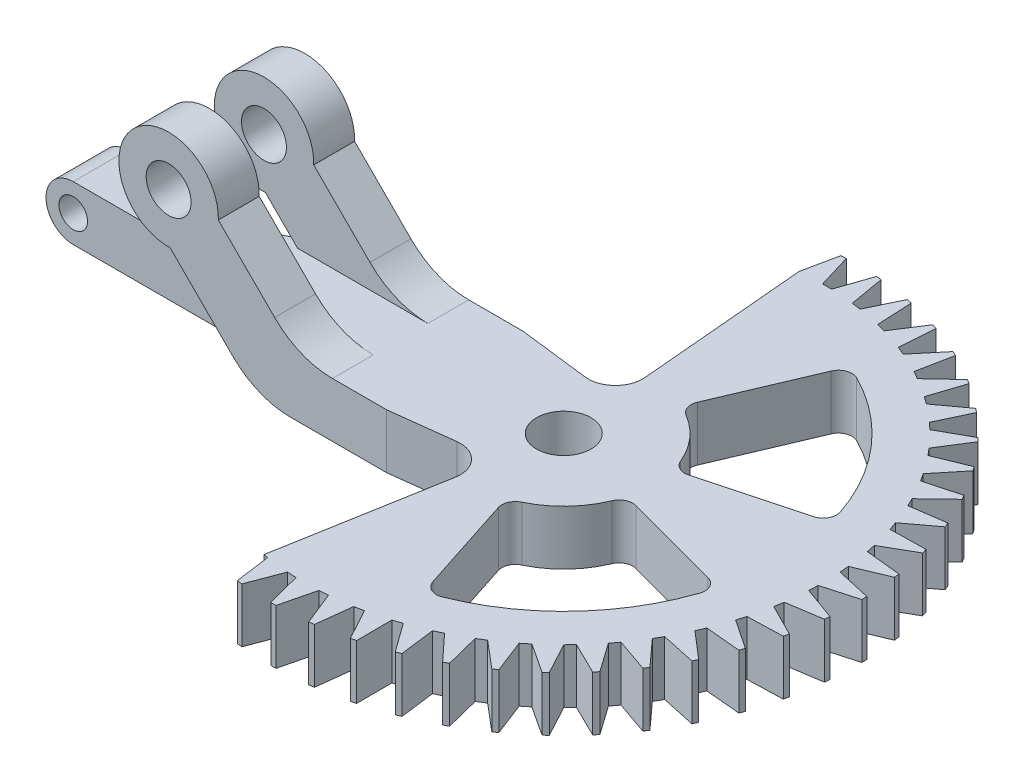
from build123d import *

# Parameters (mm, degrees)
SKETCH1_R           = 1.65
BOSS_EXTRUDE1_DEPTH = 5
SKETCH3_W           = 10.114466094
SKETCH3_H           = 4
CUT_EXTRUDE1_DEPTH  = 22.617643257
SKETCH4_R           = 2
BOSS_EXTRUDE2_DEPTH = 4
SKETCH5_R           = 1.05
BOSS_EXTRUDE3_DEPTH = 2
CUT_EXTRUDE3_REACH  = 54.142
CIRPATTERN2_COUNT   = 29
CIRPATTERN2_ANGLE   = 196
CUT_EXTRUDE4_REACH  = 53.238
FILLET3_R           = 1
SKETCH9_W           = 5
SKETCH9_H           = 4
CUT_EXTRUDE6_DEPTH  = 52.237920784
FILLET4_R           = 6
FILLET5_R           = 2


with BuildPart() as part:
    # Sketch1 → Boss-Extrude1 (new, symmetric)
    with BuildSketch(Plane.XY):
        with BuildLine():
            Line((6.464466094, -10), (16, -10))
            Line((16, -10), (16, -6))
            Line((16, -6), (9.535533906, -6))
            Line((9.535533906, -6), (3.64825891, -0.112725004))
            ThreePointArc((3.64825891, -0.112725004), (-2.580939751, 2.580939751), (0.112725004, -3.64825891))
            Line((0.112725004, -3.64825891), (6.464466094, -10))
        make_face()
        Circle(SKETCH1_R, mode=Mode.SUBTRACT)
    extrude(amount=BOSS_EXTRUDE1_DEPTH, both=True)

    # Sketch3 → Cut-Extrude1 (cut, through all)
    with BuildSketch(Plane.XZ.offset(10)):
        with Locations((1.407233047, 0)):
            Rectangle(SKETCH3_W, SKETCH3_H)
    extrude(amount=-CUT_EXTRUDE1_DEPTH, mode=Mode.SUBTRACT)

    # Sketch4 → Boss-Extrude2 (add)
    with BuildSketch(Plane.XZ.offset(10)):
        with BuildLine():
            Line((16, 5), (16, -5))
            Line((16, -5), (21.195465554, -4.369618468))
            ThreePointArc((21.195465554, -4.369618468), (22.826710059, -4.917371633), (23.428754248, -6.529368829))
            Line((23.428754248, -6.529368829), (22.126151531, -21.418186009))
            ThreePointArc((22.126151531, -21.418186009), (45.479536764, 0.937816828), (20.26656418, 21.17336669))
            Line((20.26656418, 21.17336669), (22.805344024, 6.77523072))
            ThreePointArc((22.805344024, 6.77523072), (22.287461395, 5.052263018), (20.59482922, 4.442495489))
            Line((20.59482922, 4.442495489), (16, 5))
        make_face()
        with Locations(Location((24, 0, 0), (0, 0, 270))):
            Circle(SKETCH4_R, mode=Mode.SUBTRACT)
    extrude(amount=-BOSS_EXTRUDE2_DEPTH)

    # Sketch5 → Boss-Extrude3 (add, symmetric)
    with BuildSketch(Plane.XY):
        with BuildLine():
            Line((6.464466094, -10), (-10, -10))
            ThreePointArc((-10, -10), (-12, -8), (-10, -6))
            Line((-10, -6), (9.535533906, -6))
            Line((9.535533906, -6), (16, -6))
            Line((16, -6), (16, -10))
            Line((16, -10), (6.464466094, -10))
        make_face()
        with Locations((-10, -8)):
            Circle(SKETCH5_R, mode=Mode.SUBTRACT)
    extrude(amount=BOSS_EXTRUDE3_DEPTH, both=True)

    # Sketch7 → Cut-Extrude3 (cut, up to next)
    with BuildSketch(Plane.XZ.offset(10), mode=Mode.PRIVATE) as cut_extrude3_sk1:
        with BuildLine():
            Line((20.636659002, -21.235299323), (21.684482475, -18.858376881))
            ThreePointArc((21.684482475, -18.858376881), (22.013959198, -18.895916012), (22.344040888, -18.927699264))
            Line((22.344040888, -18.927699264), (22.874776941, -21.470534997))
            ThreePointArc((22.874776941, -21.470534997), (21.75263804, -21.38222075), (20.636659002, -21.235299323))
        make_face()
    cut_extrude3_tool1 = extrude(cut_extrude3_sk1.sketch, amount=-CUT_EXTRUDE3_REACH, mode=Mode.PRIVATE) & part.part
    cut_extrude3 = cut_extrude3_tool1.solids().sort_by_distance((21.860164, -10, -20.359178))[0]
    add(cut_extrude3, mode=Mode.SUBTRACT)

    # CirPattern2: Cut-Extrude3; each copy of Cut-Extrude3 runs up to whatever stops it at its own place
    cirpattern2_before = part.part  # the part as the pattern finds it: every copy runs up to it
    cirpattern2_cut_extrude3_long = extrude(cut_extrude3_sk1.sketch, amount=-CUT_EXTRUDE3_REACH, mode=Mode.PRIVATE)
    cirpattern2_cut_extrude3_tool1 = cirpattern2_cut_extrude3_long.rotate(Axis((24, 0, 0), (0, -1, 0)), 1 * CIRPATTERN2_ANGLE / (CIRPATTERN2_COUNT - 1)) & cirpattern2_before
    add(cirpattern2_cut_extrude3_tool1.solids().sort_by_distance((24.357274, -10, -20.468204))[0], mode=Mode.SUBTRACT)
    cirpattern2_cut_extrude3_tool2 = cirpattern2_cut_extrude3_long.rotate(Axis((24, 0, 0), (0, -1, 0)), 2 * CIRPATTERN2_ANGLE / (CIRPATTERN2_COUNT - 1)) & cirpattern2_before
    add(cirpattern2_cut_extrude3_tool2.solids().sort_by_distance((26.849057, -10, -20.272097))[0], mode=Mode.SUBTRACT)
    cirpattern2_cut_extrude3_tool3 = cirpattern2_cut_extrude3_long.rotate(Axis((24, 0, 0), (0, -1, 0)), 3 * CIRPATTERN2_ANGLE / (CIRPATTERN2_COUNT - 1)) & cirpattern2_before
    add(cirpattern2_cut_extrude3_tool3.solids().sort_by_distance((29.298368, -10, -19.773779))[0], mode=Mode.SUBTRACT)
    cirpattern2_cut_extrude3_tool4 = cirpattern2_cut_extrude3_long.rotate(Axis((24, 0, 0), (0, -1, 0)), 4 * CIRPATTERN2_ANGLE / (CIRPATTERN2_COUNT - 1)) & cirpattern2_before
    add(cirpattern2_cut_extrude3_tool4.solids().sort_by_distance((31.668692, -10, -18.980679))[0], mode=Mode.SUBTRACT)
    cirpattern2_cut_extrude3_tool5 = cirpattern2_cut_extrude3_long.rotate(Axis((24, 0, 0), (0, -1, 0)), 5 * CIRPATTERN2_ANGLE / (CIRPATTERN2_COUNT - 1)) & cirpattern2_before
    add(cirpattern2_cut_extrude3_tool5.solids().sort_by_distance((33.924694, -10, -17.904622))[0], mode=Mode.SUBTRACT)
    cirpattern2_cut_extrude3_tool6 = cirpattern2_cut_extrude3_long.rotate(Axis((24, 0, 0), (0, -1, 0)), 6 * CIRPATTERN2_ANGLE / (CIRPATTERN2_COUNT - 1)) & cirpattern2_before
    add(cirpattern2_cut_extrude3_tool6.solids().sort_by_distance((36.032741, -10, -16.561648))[0], mode=Mode.SUBTRACT)
    cirpattern2_cut_extrude3_tool7 = cirpattern2_cut_extrude3_long.rotate(Axis((24, 0, 0), (0, -1, 0)), 7 * CIRPATTERN2_ANGLE / (CIRPATTERN2_COUNT - 1)) & cirpattern2_before
    add(cirpattern2_cut_extrude3_tool7.solids().sort_by_distance((37.961408, -10, -14.971777))[0], mode=Mode.SUBTRACT)
    cirpattern2_cut_extrude3_tool8 = cirpattern2_cut_extrude3_long.rotate(Axis((24, 0, 0), (0, -1, 0)), 8 * CIRPATTERN2_ANGLE / (CIRPATTERN2_COUNT - 1)) & cirpattern2_before
    add(cirpattern2_cut_extrude3_tool8.solids().sort_by_distance((39.681942, -10, -13.158712))[0], mode=Mode.SUBTRACT)
    cirpattern2_cut_extrude3_tool9 = cirpattern2_cut_extrude3_long.rotate(Axis((24, 0, 0), (0, -1, 0)), 9 * CIRPATTERN2_ANGLE / (CIRPATTERN2_COUNT - 1)) & cirpattern2_before
    add(cirpattern2_cut_extrude3_tool9.solids().sort_by_distance((41.168695, -10, -11.149481))[0], mode=Mode.SUBTRACT)
    cirpattern2_cut_extrude3_tool10 = cirpattern2_cut_extrude3_long.rotate(Axis((24, 0, 0), (0, -1, 0)), 10 * CIRPATTERN2_ANGLE / (CIRPATTERN2_COUNT - 1)) & cirpattern2_before
    add(cirpattern2_cut_extrude3_tool10.solids().sort_by_distance((42.399502, -10, -8.974037))[0], mode=Mode.SUBTRACT)
    cirpattern2_cut_extrude3_tool11 = cirpattern2_cut_extrude3_long.rotate(Axis((24, 0, 0), (0, -1, 0)), 11 * CIRPATTERN2_ANGLE / (CIRPATTERN2_COUNT - 1)) & cirpattern2_before
    add(cirpattern2_cut_extrude3_tool11.solids().sort_by_distance((43.356015, -10, -6.664811))[0], mode=Mode.SUBTRACT)
    cirpattern2_cut_extrude3_tool12 = cirpattern2_cut_extrude3_long.rotate(Axis((24, 0, 0), (0, -1, 0)), 12 * CIRPATTERN2_ANGLE / (CIRPATTERN2_COUNT - 1)) & cirpattern2_before
    add(cirpattern2_cut_extrude3_tool12.solids().sort_by_distance((44.023975, -10, -4.256227))[0], mode=Mode.SUBTRACT)
    cirpattern2_cut_extrude3_tool13 = cirpattern2_cut_extrude3_long.rotate(Axis((24, 0, 0), (0, -1, 0)), 13 * CIRPATTERN2_ANGLE / (CIRPATTERN2_COUNT - 1)) & cirpattern2_before
    add(cirpattern2_cut_extrude3_tool13.solids().sort_by_distance((44.393422, -10, -1.784193))[0], mode=Mode.SUBTRACT)
    cirpattern2_cut_extrude3_tool14 = cirpattern2_cut_extrude3_long.rotate(Axis((24, 0, 0), (0, -1, 0)), 14 * CIRPATTERN2_ANGLE / (CIRPATTERN2_COUNT - 1)) & cirpattern2_before
    add(cirpattern2_cut_extrude3_tool14.solids().sort_by_distance((44.458851, -10, 0.714439))[0], mode=Mode.SUBTRACT)
    cirpattern2_cut_extrude3_tool15 = cirpattern2_cut_extrude3_long.rotate(Axis((24, 0, 0), (0, -1, 0)), 15 * CIRPATTERN2_ANGLE / (CIRPATTERN2_COUNT - 1)) & cirpattern2_before
    add(cirpattern2_cut_extrude3_tool15.solids().sort_by_distance((44.219286, -10, 3.20242))[0], mode=Mode.SUBTRACT)
    cirpattern2_cut_extrude3_tool16 = cirpattern2_cut_extrude3_long.rotate(Axis((24, 0, 0), (0, -1, 0)), 16 * CIRPATTERN2_ANGLE / (CIRPATTERN2_COUNT - 1)) & cirpattern2_before
    add(cirpattern2_cut_extrude3_tool16.solids().sort_by_distance((43.678298, -10, 5.642661))[0], mode=Mode.SUBTRACT)
    cirpattern2_cut_extrude3_tool17 = cirpattern2_cut_extrude3_long.rotate(Axis((24, 0, 0), (0, -1, 0)), 17 * CIRPATTERN2_ANGLE / (CIRPATTERN2_COUNT - 1)) & cirpattern2_before
    add(cirpattern2_cut_extrude3_tool17.solids().sort_by_distance((42.843951, -10, 7.998783))[0], mode=Mode.SUBTRACT)
    cirpattern2_cut_extrude3_tool18 = cirpattern2_cut_extrude3_long.rotate(Axis((24, 0, 0), (0, -1, 0)), 18 * CIRPATTERN2_ANGLE / (CIRPATTERN2_COUNT - 1)) & cirpattern2_before
    add(cirpattern2_cut_extrude3_tool18.solids().sort_by_distance((41.728685, -10, 10.235661))[0], mode=Mode.SUBTRACT)
    cirpattern2_cut_extrude3_tool19 = cirpattern2_cut_extrude3_long.rotate(Axis((24, 0, 0), (0, -1, 0)), 19 * CIRPATTERN2_ANGLE / (CIRPATTERN2_COUNT - 1)) & cirpattern2_before
    add(cirpattern2_cut_extrude3_tool19.solids().sort_by_distance((40.349125, -10, 12.319949))[0], mode=Mode.SUBTRACT)
    cirpattern2_cut_extrude3_tool20 = cirpattern2_cut_extrude3_long.rotate(Axis((24, 0, 0), (0, -1, 0)), 20 * CIRPATTERN2_ANGLE / (CIRPATTERN2_COUNT - 1)) & cirpattern2_before
    add(cirpattern2_cut_extrude3_tool20.solids().sort_by_distance((38.725837, -10, 14.220575))[0], mode=Mode.SUBTRACT)
    cirpattern2_cut_extrude3_tool21 = cirpattern2_cut_extrude3_long.rotate(Axis((24, 0, 0), (0, -1, 0)), 21 * CIRPATTERN2_ANGLE / (CIRPATTERN2_COUNT - 1)) & cirpattern2_before
    add(cirpattern2_cut_extrude3_tool21.solids().sort_by_distance((36.883021, -10, 15.909205))[0], mode=Mode.SUBTRACT)
    cirpattern2_cut_extrude3_tool22 = cirpattern2_cut_extrude3_long.rotate(Axis((24, 0, 0), (0, -1, 0)), 22 * CIRPATTERN2_ANGLE / (CIRPATTERN2_COUNT - 1)) & cirpattern2_before
    add(cirpattern2_cut_extrude3_tool22.solids().sort_by_distance((34.848148, -10, 17.360666))[0], mode=Mode.SUBTRACT)
    cirpattern2_cut_extrude3_tool23 = cirpattern2_cut_extrude3_long.rotate(Axis((24, 0, 0), (0, -1, 0)), 23 * CIRPATTERN2_ANGLE / (CIRPATTERN2_COUNT - 1)) & cirpattern2_before
    add(cirpattern2_cut_extrude3_tool23.solids().sort_by_distance((32.651555, -10, 18.553319))[0], mode=Mode.SUBTRACT)
    cirpattern2_cut_extrude3_tool24 = cirpattern2_cut_extrude3_long.rotate(Axis((24, 0, 0), (0, -1, 0)), 24 * CIRPATTERN2_ANGLE / (CIRPATTERN2_COUNT - 1)) & cirpattern2_before
    add(cirpattern2_cut_extrude3_tool24.solids().sort_by_distance((30.325987, -10, 19.469384))[0], mode=Mode.SUBTRACT)
    cirpattern2_cut_extrude3_tool25 = cirpattern2_cut_extrude3_long.rotate(Axis((24, 0, 0), (0, -1, 0)), 25 * CIRPATTERN2_ANGLE / (CIRPATTERN2_COUNT - 1)) & cirpattern2_before
    add(cirpattern2_cut_extrude3_tool25.solids().sort_by_distance((27.906113, -10, 20.095206))[0], mode=Mode.SUBTRACT)
    cirpattern2_cut_extrude3_tool26 = cirpattern2_cut_extrude3_long.rotate(Axis((24, 0, 0), (0, -1, 0)), 26 * CIRPATTERN2_ANGLE / (CIRPATTERN2_COUNT - 1)) & cirpattern2_before
    add(cirpattern2_cut_extrude3_tool26.solids().sort_by_distance((25.428007, -10, 20.421455))[0], mode=Mode.SUBTRACT)
    cirpattern2_cut_extrude3_tool27 = cirpattern2_cut_extrude3_long.rotate(Axis((24, 0, 0), (0, -1, 0)), 27 * CIRPATTERN2_ANGLE / (CIRPATTERN2_COUNT - 1)) & cirpattern2_before
    add(cirpattern2_cut_extrude3_tool27.solids().sort_by_distance((22.928614, -10, 20.443267))[0], mode=Mode.SUBTRACT)
    cirpattern2_cut_extrude3_tool28 = cirpattern2_cut_extrude3_long.rotate(Axis((24, 0, 0), (0, -1, 0)), 28 * CIRPATTERN2_ANGLE / (CIRPATTERN2_COUNT - 1)) & cirpattern2_before
    add(cirpattern2_cut_extrude3_tool28.solids().sort_by_distance((20.445192, -10, 20.160317))[0], mode=Mode.SUBTRACT)

    # Sketch8 → Cut-Extrude4 (cut, up to next)
    with BuildSketch(Plane(origin=(0, -6, 0), x_dir=(1, 0, 0), z_dir=(0, 1, 0)), mode=Mode.PRIVATE) as cut_extrude4_sk1:
        with BuildLine():
            Line((26.560972926, 6.033274126), (30.251698056, 14.728077655))
            ThreePointArc((30.251698056, 14.728077655), (36.075353284, 10.496944464), (39.454813221, 4.141104722))
            Line((39.454813221, 4.141104722), (30.330977261, 1.696380244))
            ThreePointArc((30.330977261, 1.696380244), (28.946600516, 4.300014226), (26.560972926, 6.033274126))
        make_face()
    cut_extrude4_tool1 = extrude(cut_extrude4_sk1.sketch, amount=-CUT_EXTRUDE4_REACH, mode=Mode.PRIVATE) & part.part
    # Sketch8 → Cut-Extrude4 (cut, up to next)
    with BuildSketch(Plane(origin=(0, -6, 0), x_dir=(1, 0, 0), z_dir=(0, 1, 0)), mode=Mode.PRIVATE) as cut_extrude4_sk2:
        with BuildLine():
            Line((28.94427191, -15.216904261), (26.025393163, -6.233519194))
            ThreePointArc((26.025393163, -6.233519194), (28.754328462, -4.511689249), (30.330977261, -1.696380244))
            Line((30.330977261, -1.696380244), (39.454813221, -4.141104722))
            ThreePointArc((39.454813221, -4.141104722), (35.605989936, -11.013673211), (28.94427191, -15.216904261))
        make_face()
    cut_extrude4_tool2 = extrude(cut_extrude4_sk2.sketch, amount=-CUT_EXTRUDE4_REACH, mode=Mode.PRIVATE) & part.part
    add(cut_extrude4_tool1.solids().sort_by_distance((32.702553, -6, -7.565014))[0], mode=Mode.SUBTRACT)
    add(cut_extrude4_tool2.solids().sort_by_distance((32.305742, -6, 7.881855))[0], mode=Mode.SUBTRACT)

    # Fillet3
    fillet3_edges = [part.edges().sort_by_distance(p)[0] for p in [
        (26.025393163, -8, 6.233519194),
        (30.330977261, -8, 1.696380244),
        (39.454813221, -8, 4.141104722),
        (28.94427191, -8, 15.216904261),
        (30.330977261, -8, -1.696380244),
        (26.560972926, -8, -6.033274126),
        (30.251698056, -8, -14.728077655),
        (39.454813221, -8, -4.141104722),
    ]]
    fillet(fillet3_edges, radius=FILLET3_R)

    # Sketch9 → Cut-Extrude6 (cut, through all)
    with BuildSketch(Plane(origin=(0, -6, 0), x_dir=(1, 0, 0), z_dir=(0, 1, 0))):
        with Locations((8.964466094, 0)):
            Rectangle(SKETCH9_W, SKETCH9_H)
    extrude(amount=CUT_EXTRUDE6_DEPTH, mode=Mode.SUBTRACT)

    # Fillet4
    fillet4_edges = [part.edges().sort_by_distance(p)[0] for p in [
        (6.464466094, -10, 3.5),
        (9.535533906, -6, 3.5),
        (6.464466094, -10, -3.5),
        (9.535533906, -6, -3.5),
    ]]
    fillet(fillet4_edges, radius=FILLET4_R)

    # Fillet5
    # the kernel refuses this fillet: 2 mm, written as the material it adds along each edge
    with BuildSketch(Plane(origin=(-1.071067812, -2.464466094, -2), x_dir=(0, 0, -1), z_dir=(0.7071067811865491, -0.707106781186546, 0))) as fillet5_piece_1_section:
        with BuildLine():
            CenterArc((FILLET5_R, -FILLET5_R), FILLET5_R, 90, 90)
            Line((0, -FILLET5_R), (0, 0))
            Line((0, 0), (FILLET5_R, 0))
        make_face()
    fillet5_piece_1 = extrude(amount=8.171572875, mode=Mode.PRIVATE)
    fillet5_piece_1 = split(fillet5_piece_1, bisect_by=Plane(origin=(3.070726254, -6, -2.423870706), z_dir=(0, -1, 0)), keep=Keep.TOP, mode=Mode.PRIVATE)
    add(fillet5_piece_1)
    with BuildSketch(Plane(origin=(8.949747468, -4, 2), x_dir=(0.7402331123820542, -0.6723503099822121, 0), z_dir=(0.6723503099822121, 0.7402331123820542, 0))) as fillet5_piece_2_section:
        with BuildLine():
            CenterArc((6 + FILLET5_R, -FILLET5_R), FILLET5_R, 90, 90)
            Line((6, -FILLET5_R), (6, 0))
            Line((6, 0), (6 + FILLET5_R, 0))
        make_face()
    fillet5_piece_2 = revolve(axis=Axis((8.949747468, -4, 2), (0, 0, -1)), revolution_arc=92.751276954, mode=Mode.PRIVATE)
    fillet5_piece_2 = split(fillet5_piece_2, bisect_by=Plane(origin=(6.626523575, -10, 2.690704075), z_dir=(0, 1, 0)), keep=Keep.TOP, mode=Mode.PRIVATE)
    add(fillet5_piece_2)
    with BuildSketch(Plane(origin=(8.949747468, -4, -2), x_dir=(0.7402331123820542, -0.6723503099822121, 0), z_dir=(0.6723503099822121, 0.7402331123820542, 0))) as fillet5_piece_3_section:
        with BuildLine():
            CenterArc((6 + FILLET5_R, FILLET5_R), FILLET5_R, 180, 90)
            Line((6 + FILLET5_R, 0), (6, 0))
            Line((6, 0), (6, FILLET5_R))
        make_face()
    fillet5_piece_3 = revolve(axis=Axis((8.949747468, -4, -2), (0, 0, -1)), revolution_arc=92.751276954, mode=Mode.PRIVATE)
    fillet5_piece_3 = split(fillet5_piece_3, bisect_by=Plane(origin=(6.626511695, -10, -2.690616224), z_dir=(0, 1, 0)), keep=Keep.TOP, mode=Mode.PRIVATE)
    add(fillet5_piece_3)
    with BuildSketch(Plane(origin=(4.707106781, -8.242640687, 2), x_dir=(0, 0, 1), z_dir=(-0.7071067811865491, 0.707106781186546, 0))) as fillet5_piece_4_section:
        with BuildLine():
            CenterArc((FILLET5_R, -FILLET5_R), FILLET5_R, 90, 90)
            Line((0, -FILLET5_R), (0, 0))
            Line((0, 0), (FILLET5_R, 0))
        make_face()
    fillet5_piece_4 = extrude(amount=8.171572875, mode=Mode.PRIVATE)
    fillet5_piece_4 = split(fillet5_piece_4, bisect_by=Plane(origin=(3.070726254, -6, 2.423870706), z_dir=(0, -1, 0)), keep=Keep.TOP, mode=Mode.PRIVATE)
    add(fillet5_piece_4)


solid = part.part
